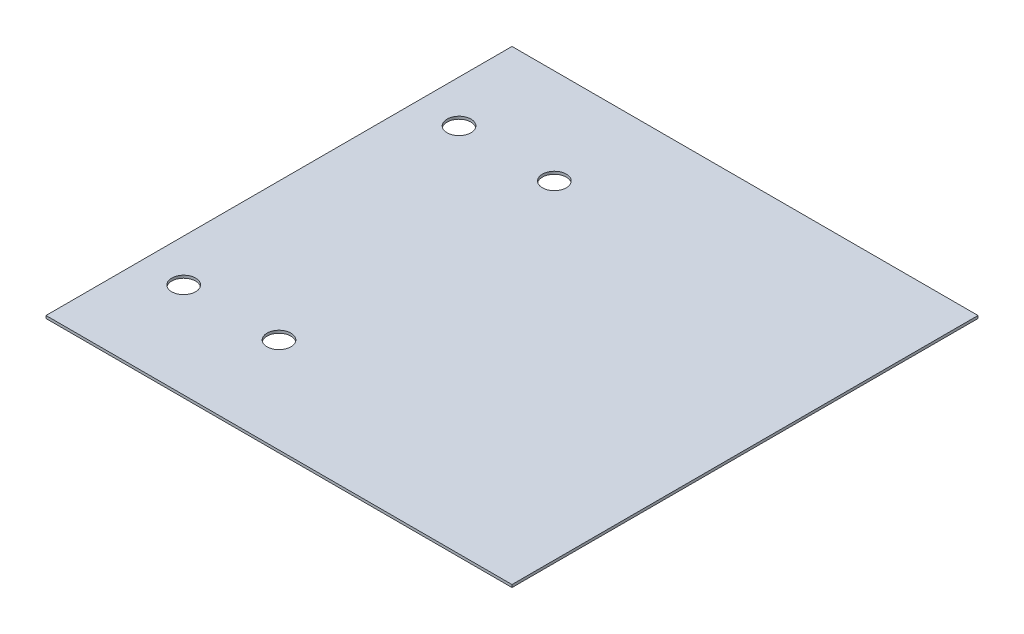
from build123d import *

# Parameters (mm, degrees)
SKETCH1_W           = 558.8
SKETCH1_H           = 558.8
BOSS_EXTRUDE1_DEPTH = 3.175
SKETCH2_R           = 14.2875
CUT_EXTRUDE1_DEPTH  = 3.175


with BuildPart() as part:
    # Sketch1 → Boss-Extrude1 (new body)
    with BuildSketch(Plane(origin=(0, 0, 0), x_dir=(1, 0, 0), z_dir=(0, 1, 0))):
        with Locations((279.4, 279.4)):
            Rectangle(SKETCH1_W, SKETCH1_H)
    extrude(amount=BOSS_EXTRUDE1_DEPTH)

    # Sketch2 → Cut-Extrude1 (cut)
    with BuildSketch(Plane(origin=(0, 3.175, 0), x_dir=(1, 0, 0), z_dir=(0, 1, 0))):
        with Locations((50.8, 444.5)):
            Circle(SKETCH2_R)
        with Locations((165.1, 444.5)):
            Circle(SKETCH2_R)
        with Locations((50.8, 114.3)):
            Circle(SKETCH2_R)
        with Locations((165.1, 114.3)):
            Circle(SKETCH2_R)
    extrude(amount=-CUT_EXTRUDE1_DEPTH, mode=Mode.SUBTRACT)


solid = part.part
